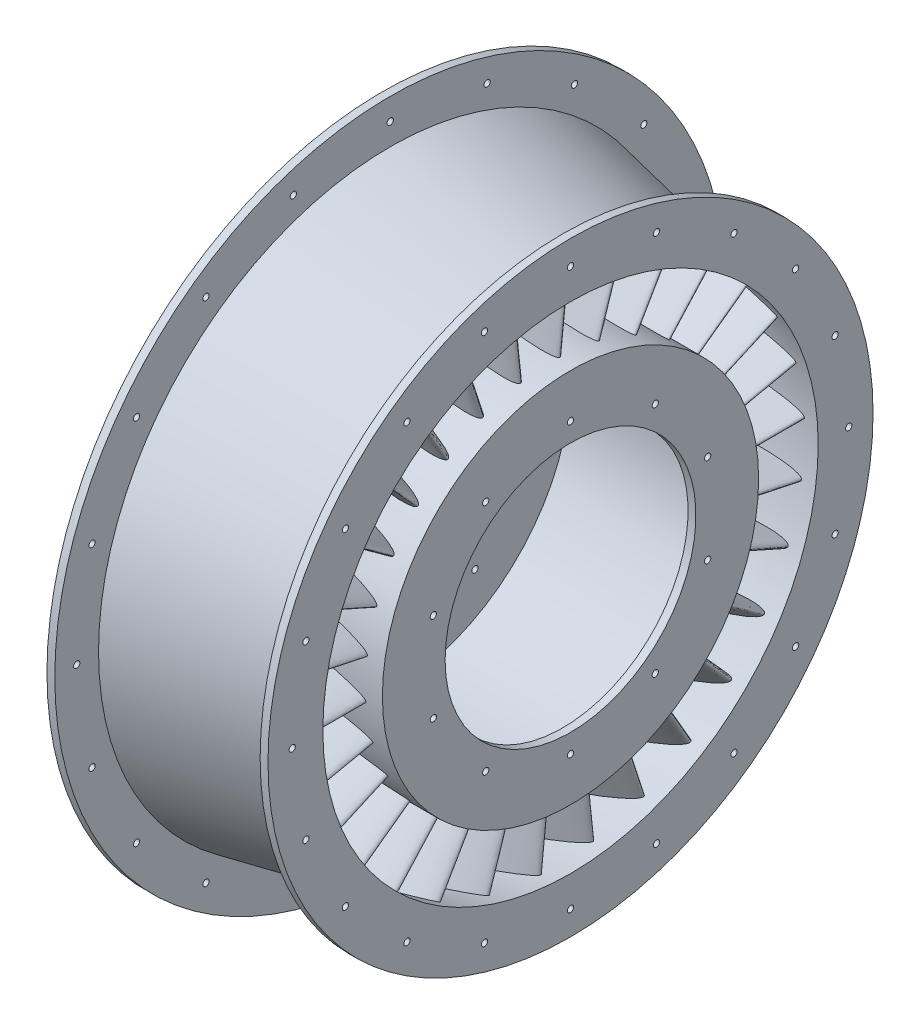
from build123d import *

# Parameters (mm, degrees)
BOSS_EXTRUDE1_REACH = 425.532
BOSS_EXTRUDE1_START = 115
SKETCH2_RX          = 50
SKETCH2_RY          = 6
CIRPATTERN1_COUNT   = 30
SKETCH3_R           = 2
CUT_EXTRUDE1_DEPTH  = 326.564125825
SKETCH4_R           = 2
CUT_EXTRUDE2_DEPTH  = 5


with BuildPart() as part:
    # Sketch1 → Revolve1 (revolve)
    with BuildSketch(Plane.XY):
        Polygon((60, 120), (60, 80), (55, 80), (55, 115), (-55, 115), (-55, 80), (-60, 80), (-60, 120), align=None)
        Polygon((60, 158), (-60, 182), (-60, 214), (-55, 214), (-55, 186.099019514), (55, 164.099019514), (55, 193), (60, 193), align=None)
    revolve(axis=Axis((-164.89354733, 0, 0), (1, 0, 0)))

    # Boss-Extrude1: up to this cone (the profile starts inside it)
    boss_extrude1_end = Plane(origin=(0, 0, 0), z_dir=(-1, 0, 0)) * Cone(50.7936, 289.2064, 1192.064, mode=Mode.PRIVATE)
    # Sketch2 → Boss-Extrude1 (add, up to the surface)
    with BuildSketch(Plane.XY.offset(BOSS_EXTRUDE1_START), mode=Mode.PRIVATE) as boss_extrude1_sk1:
        with Locations(Location((0, 0), (0, 0, 170))):
            Ellipse(SKETCH2_RX, SKETCH2_RY)
    boss_extrude1_tool1 = extrude(boss_extrude1_sk1.sketch, amount=BOSS_EXTRUDE1_REACH, mode=Mode.PRIVATE) & boss_extrude1_end
    boss_extrude1 = boss_extrude1_tool1.solids().sort_by_distance((0, 0, 115))[0]
    add(boss_extrude1)

    # CirPattern1: Boss-Extrude1 ×30 about axis
    cirpattern1_axis = Axis((-60, 0, 0), (-1, 0, 0))
    for i in range(1, CIRPATTERN1_COUNT):
        add(boss_extrude1.rotate(cirpattern1_axis, i * 360 / CIRPATTERN1_COUNT))

    # Sketch3 → Cut-Extrude1 (cut, through all)
    with BuildSketch(Plane.ZY.offset(60)):
        with Locations((0, 92)):
            Circle(SKETCH3_R)
        with Locations((0, 200)):
            Circle(SKETCH3_R)
        with Locations((61.803398875, 190.211303259)):
            Circle(SKETCH3_R)
        with Locations((117.557050458, 161.803398875)):
            Circle(SKETCH3_R)
        with Locations((54.076243211, 74.429563483)):
            Circle(SKETCH3_R)
        with Locations((161.803398875, 117.557050459)):
            Circle(SKETCH3_R)
        with Locations((190.211303259, 61.803398875)):
            Circle(SKETCH3_R)
        with Locations((87.497199499, 28.429563483)):
            Circle(SKETCH3_R)
        with Locations((200, 0)):
            Circle(SKETCH3_R)
        with Locations((190.211303259, -61.803398875)):
            Circle(SKETCH3_R)
        with Locations((87.497199499, -28.429563482)):
            Circle(SKETCH3_R)
        with Locations((161.803398875, -117.557050458)):
            Circle(SKETCH3_R)
        with Locations((117.557050459, -161.803398875)):
            Circle(SKETCH3_R)
        with Locations((54.076243211, -74.429563482)):
            Circle(SKETCH3_R)
        with Locations((61.803398875, -190.211303259)):
            Circle(SKETCH3_R)
        with Locations((0, -200)):
            Circle(SKETCH3_R)
        with Locations((0, -92)):
            Circle(SKETCH3_R)
        with Locations((-61.803398875, -190.211303259)):
            Circle(SKETCH3_R)
        with Locations((-117.557050458, -161.803398875)):
            Circle(SKETCH3_R)
        with Locations((-54.076243211, -74.429563483)):
            Circle(SKETCH3_R)
        with Locations((-161.803398875, -117.557050459)):
            Circle(SKETCH3_R)
        with Locations((-190.211303259, -61.803398875)):
            Circle(SKETCH3_R)
        with Locations((-87.497199499, -28.429563483)):
            Circle(SKETCH3_R)
        with Locations((-200, 0)):
            Circle(SKETCH3_R)
        with Locations((-190.211303259, 61.803398875)):
            Circle(SKETCH3_R)
        with Locations((-87.497199499, 28.429563482)):
            Circle(SKETCH3_R)
        with Locations((-161.803398875, 117.557050458)):
            Circle(SKETCH3_R)
        with Locations((-117.557050458, 161.803398875)):
            Circle(SKETCH3_R)
        with Locations((-54.076243211, 74.429563482)):
            Circle(SKETCH3_R)
        with Locations((-61.803398875, 190.211303259)):
            Circle(SKETCH3_R)
    extrude(amount=-CUT_EXTRUDE1_DEPTH, mode=Mode.SUBTRACT)

    # Sketch4 → Cut-Extrude2 (cut)
    with BuildSketch(Plane(origin=(60, 0, 0), x_dir=(0, 0, -1), z_dir=(1, 0, 0))):
        with Locations((0, 177.5)):
            Circle(SKETCH4_R)
        with Locations((54.850516502, 168.812531642)):
            Circle(SKETCH4_R)
        with Locations((104.331882282, 143.600516502)):
            Circle(SKETCH4_R)
        with Locations((143.600516502, 104.331882282)):
            Circle(SKETCH4_R)
        with Locations((168.812531642, 54.850516502)):
            Circle(SKETCH4_R)
        with Locations((177.5, 0)):
            Circle(SKETCH4_R)
        with Locations((168.812531642, -54.850516502)):
            Circle(SKETCH4_R)
        with Locations((143.600516502, -104.331882282)):
            Circle(SKETCH4_R)
        with Locations((104.331882282, -143.600516502)):
            Circle(SKETCH4_R)
        with Locations((54.850516502, -168.812531642)):
            Circle(SKETCH4_R)
        with Locations((0, -177.5)):
            Circle(SKETCH4_R)
        with Locations((-54.850516502, -168.812531642)):
            Circle(SKETCH4_R)
        with Locations((-104.331882282, -143.600516502)):
            Circle(SKETCH4_R)
        with Locations((-143.600516502, -104.331882282)):
            Circle(SKETCH4_R)
        with Locations((-168.812531642, -54.850516502)):
            Circle(SKETCH4_R)
        with Locations((-177.5, 0)):
            Circle(SKETCH4_R)
        with Locations((-168.812531642, 54.850516502)):
            Circle(SKETCH4_R)
        with Locations((-143.600516502, 104.331882282)):
            Circle(SKETCH4_R)
        with Locations((-104.331882282, 143.600516502)):
            Circle(SKETCH4_R)
        with Locations((-54.850516502, 168.812531642)):
            Circle(SKETCH4_R)
    extrude(amount=-CUT_EXTRUDE2_DEPTH, mode=Mode.SUBTRACT)


solid = part.part
